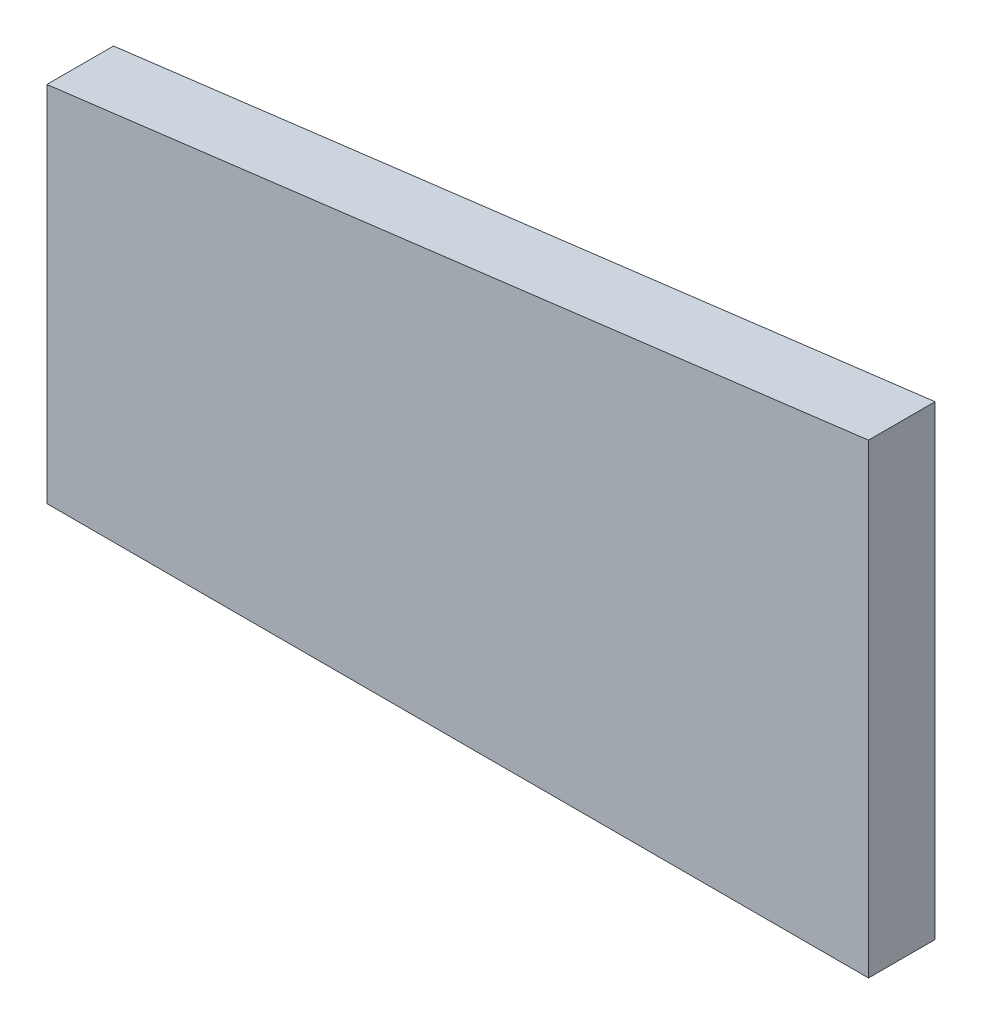
from build123d import *

# Parameters (mm, degrees)
BOSS_EXTRUDE3_DEPTH = 19.05


with BuildPart() as part:
    # Sketch5 → Boss-Extrude3 (new body)
    with BuildSketch(Plane.XY):
        Polygon((251.836295427, 131.008148634), (251.836295427, 27.19467147), (486.786295427, 27.19467147), (486.786295427, 160.396225774), align=None)
    extrude(amount=BOSS_EXTRUDE3_DEPTH)


solid = part.part
